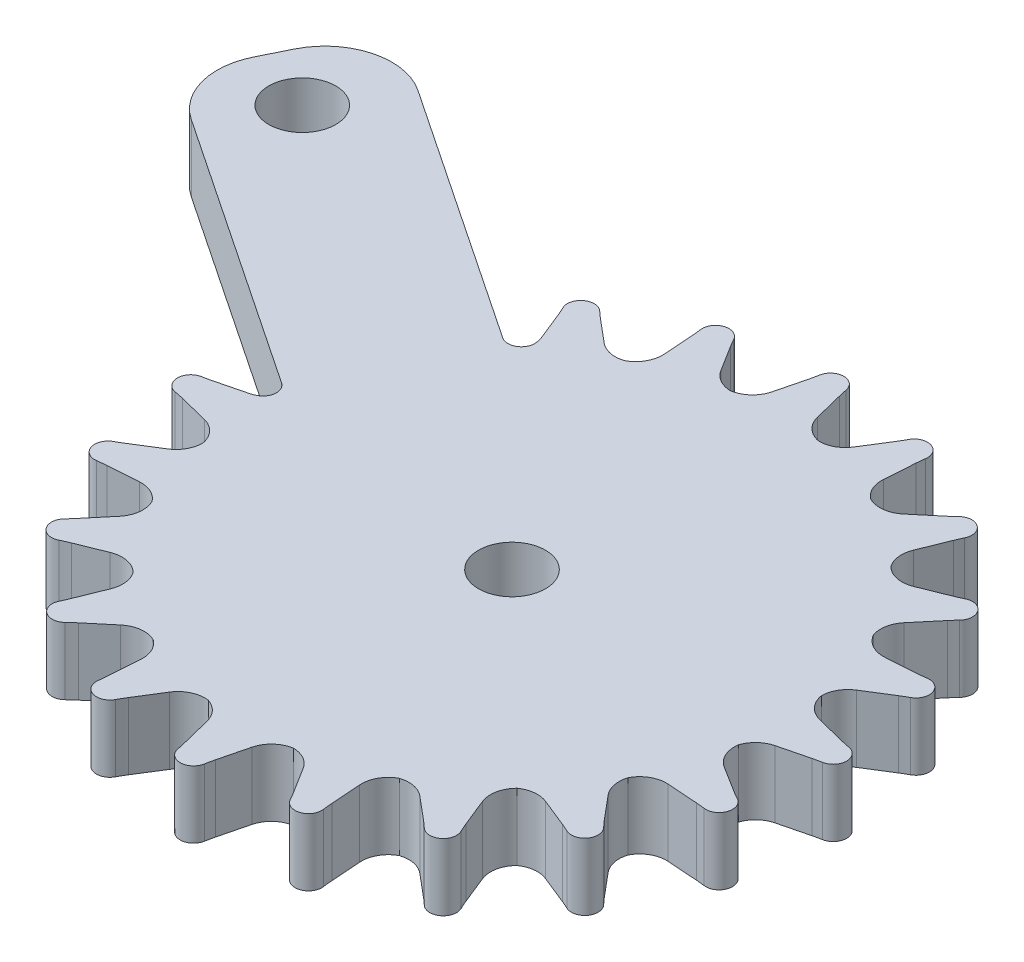
from build123d import *

# Parameters (mm, degrees)
SKETCH1_R           = 20
BOSS_EXTRUDE1_DEPTH = 5
BOSS_EXTRUDE2_START = -5
BOSS_EXTRUDE2_DEPTH = 5
FILLET1_R           = 2
CIRPATTERN1_DEPTH   = 5
SKETCH4_R           = 2.5
BOSS_EXTRUDE3_DEPTH = 5
FILLET2_R           = 5
SKETCH3_R           = 2.5
CUT_EXTRUDE1_DEPTH  = 10
FILLET3_R           = 1


# Read off the part's stored shape, not the designer's step: CirPattern1
with BuildPart() as part:
    # Sketch1 → Boss-Extrude1 (new body)
    with BuildSketch(Plane(origin=(0, 0, 0), x_dir=(1, 0, 0), z_dir=(0, 1, 0))):
        with Locations(Location((0, 0, 0), (0, 0, 270))):
            Circle(SKETCH1_R)
    extrude(amount=BOSS_EXTRUDE1_DEPTH)

    # Sketch2 → Boss-Extrude2 (add)
    with BuildSketch(Plane(origin=(0, 5, 0), x_dir=(1, 0, 0), z_dir=(0, 1, 0)).offset(BOSS_EXTRUDE2_START)):
        with BuildLine():
            Line((-2.105791814, 19.888832063), (-1.238592318, 23.357630049))
            ThreePointArc((-1.238592318, 23.357630049), (-1.158488111, 23.704119695), (-1.090754777, 24.053238521))
            ThreePointArc((-1.090754777, 24.053238521), (-0.109023339, 24.880258639), (0.877972386, 24.059528275))
            ThreePointArc((0.877972386, 24.059528275), (0.941143779, 23.742067411), (1.014556469, 23.426817347))
            Line((1.014556469, 23.426817347), (1.893724984, 19.910143286))
            ThreePointArc((1.893724984, 19.910143286), (-0.106567477, 19.999716082), (-2.105791814, 19.888832063))
        make_face()
    extrude(amount=BOSS_EXTRUDE2_DEPTH)

    # Fillet1
    fillet1_edges = [part.edges().sort_by_distance(p)[0] for p in [
        (1.893724984, 2.5, -19.910143286),
        (-2.105791814, 2.5, -19.888832063),
    ]]
    fillet(fillet1_edges, radius=FILLET1_R)

    # CirPattern1 outline → CirPattern1 (add)
    with BuildSketch(Plane(origin=(0, 0, 0), x_dir=(1, 0, 0), z_dir=(0, 1, 0))):
        with BuildLine():
            ThreePointArc((-18.818349161, -15.020578024), (-18.496093443, -14.870168545), (-18.16869336, -14.731312705))
            Line((-18.16869336, -14.731312705), (-16.10451314, -13.898848252))
            ThreePointArc((-16.10451314, -13.898848252), (-14.969635701, -13.791456908), (-13.960430105, -14.321535926))
            ThreePointArc((-13.960430105, -14.321535926), (-16.121714854, -11.835975249), (-17.845731798, -9.029388491))
            ThreePointArc((-17.845731798, -9.029388491), (-17.643410931, -10.160914391), (-18.097403186, -11.216933153))
            Line((-18.097403186, -11.216933153), (-19.549034688, -12.94914432))
            ThreePointArc((-19.549034688, -12.94914432), (-19.760926451, -13.193835771), (-19.980626471, -13.431541317))
            ThreePointArc((-19.980626471, -13.431541317), (-20.064469753, -14.712450836), (-18.818349161, -15.020578024))
        make_face()
        with BuildLine():
            ThreePointArc((-8.242021953, 19.611282475), (-8.490583131, 18.498764143), (-9.306579914, 17.702756009))
            ThreePointArc((-9.306579914, 17.702756009), (-6.422679306, 18.940675556), (-3.380631018, 19.712212811))
            ThreePointArc((-3.380631018, 19.712212811), (-4.340011374, 19.966775936), (-5.058856916, 20.651227642))
            Line((-5.058856916, 20.651227642), (-6.274384144, 22.593742485))
            ThreePointArc((-6.274384144, 22.593742485), (-6.441621387, 22.870877344), (-6.599801755, 23.153279533))
            ThreePointArc((-6.599801755, 23.153279533), (-7.792110102, 23.628842042), (-8.470228911, 22.53892747))
            ThreePointArc((-8.470228911, 22.53892747), (-8.42676349, 22.185964985), (-8.395875928, 21.831680188))
            Line((-8.395875928, 21.831680188), (-8.242021953, 19.611282475))
        make_face()
        with BuildLine():
            ThreePointArc((-13.898848252, 16.10451314), (-13.791456908, 14.969635701), (-14.321535926, 13.960430105))
            ThreePointArc((-14.321535926, 13.960430105), (-11.961321637, 16.028935855), (-9.306579913, 17.702756008))
            ThreePointArc((-9.306579913, 17.702756008), (-10.297669185, 17.648395093), (-11.192839131, 18.077211859))
            Line((-11.192839131, 18.077211859), (-12.94914432, 19.549034688))
            ThreePointArc((-12.94914432, 19.549034688), (-13.193835771, 19.760926451), (-13.431541317, 19.980626471))
            ThreePointArc((-13.431541317, 19.980626471), (-14.712450836, 20.064469753), (-15.020578024, 18.818349161))
            ThreePointArc((-15.020578024, 18.818349161), (-14.870168545, 18.496093443), (-14.731312705, 18.16869336))
            Line((-14.731312705, 18.16869336), (-13.898848252, 16.10451314))
        make_face()
        with BuildLine():
            ThreePointArc((-18.195158445, 11.021321851), (-17.742326793, 9.975175019), (-17.934600217, 8.851560036))
            ThreePointArc((-17.934600217, 8.851560036), (-16.329106467, 11.548172233), (-14.321535925, 13.960430104))
            ThreePointArc((-14.321535925, 13.960430104), (-15.247319388, 13.602466375), (-16.231188267, 13.733672628))
            Line((-16.231188267, 13.733672628), (-18.356352028, 14.59073117))
            ThreePointArc((-18.356352028, 14.59073117), (-18.654545583, 14.716638395), (-18.948508031, 14.852130478))
            ThreePointArc((-18.948508031, 14.852130478), (-20.192634375, 14.536047367), (-20.100608305, 13.255699721))
            ThreePointArc((-20.100608305, 13.255699721), (-19.857977897, 12.995695406), (-19.624745956, 12.727228237))
            Line((-19.624745956, 12.727228237), (-18.195158445, 11.021321851))
        make_face()
        with BuildLine():
            ThreePointArc((-20.710399757, 4.85928679), (-19.956454114, 4.004274704), (-19.792100881, 2.876237597))
            ThreePointArc((-19.792100881, 2.876237597), (-19.098484585, 5.936993052), (-17.934600215, 8.851560035))
            ThreePointArc((-17.934600215, 8.851560035), (-18.704455735, 8.225033474), (-19.680715605, 8.045785833))
            Line((-19.680715605, 8.045785833), (-21.966712103, 8.204185225))
            ThreePointArc((-21.966712103, 8.204185225), (-22.289218499, 8.231783236), (-22.610662757, 8.269804472))
            ThreePointArc((-22.610662757, 8.269804472), (-23.696222171, 7.584735387), (-23.213050996, 6.395490034))
            ThreePointArc((-23.213050996, 6.395490034), (-22.901950013, 6.223188155), (-22.597172338, 6.039933339))
            Line((-22.597172338, 6.039933339), (-20.710399757, 4.85928679))
        make_face()
        with BuildLine():
            ThreePointArc((-21.198362842, -1.778409119), (-20.217104661, -2.358591919), (-19.712212811, -3.380631018))
            ThreePointArc((-19.712212811, -3.380631018), (-19.998369964, -0.255340374), (-19.792100879, 2.876237597))
            ThreePointArc((-19.792100879, 2.876237597), (-20.330669633, 2.042476989), (-21.203757377, 1.570321461))
            Line((-21.203757377, 1.570321461), (-23.426817347, 1.014556469))
            ThreePointArc((-23.426817347, 1.014556469), (-23.74206741, 0.941143779), (-24.059528275, 0.877972386))
            ThreePointArc((-24.059528275, 0.877972386), (-24.880258639, -0.109023339), (-24.053238521, -1.090754777))
            ThreePointArc((-24.053238521, -1.090754777), (-23.704119695, -1.158488111), (-23.357630049, -1.238592318))
            Line((-23.357630049, -1.238592318), (-21.198362842, -1.778409119))
        make_face()
        with BuildLine():
            ThreePointArc((-19.579720151, -8.239834962), (-18.612665626, -8.414862877), (-17.845731799, -9.029388492))
            ThreePointArc((-17.845731799, -9.029388492), (-18.990179463, -6.274797518), (-19.71221281, -3.380631018))
            ThreePointArc((-19.71221281, -3.380631018), (-19.966775936, -4.340011374), (-20.651227642, -5.058856916))
            Line((-20.651227642, -5.058856916), (-22.593742485, -6.274384144))
            ThreePointArc((-22.593742485, -6.274384144), (-22.870877344, -6.441621387), (-23.153279533, -6.599801755))
            ThreePointArc((-23.153279533, -6.599801755), (-23.628842042, -7.792110102), (-22.53892747, -8.470228911))
            ThreePointArc((-22.53892747, -8.470228911), (-22.185964985, -8.42676349), (-21.831680188, -8.395875928))
            Line((-21.831680188, -8.395875928), (-19.579720151, -8.239834962))
        make_face()
        with BuildLine():
            ThreePointArc((3.184529229, 19.744841696), (6.085729599, 19.051611356), (8.851560036, 17.934600217))
            ThreePointArc((8.851560036, 17.934600217), (8.225033474, 18.704455735), (8.045785833, 19.680715605))
            Line((8.045785833, 19.680715605), (8.204185225, 21.966712103))
            ThreePointArc((8.204185225, 21.966712103), (8.231783236, 22.289218499), (8.269804472, 22.610662757))
            ThreePointArc((8.269804472, 22.610662757), (7.584735387, 23.696222171), (6.395490034, 23.213050996))
            ThreePointArc((6.395490034, 23.213050996), (6.223188155, 22.901950013), (6.039933339, 22.597172338))
            Line((6.039933339, 22.597172338), (4.842504233, 20.683579819))
            ThreePointArc((4.842504233, 20.683579819), (4.132483288, 20.004095101), (3.184529229, 19.744841696))
        make_face()
        with BuildLine():
            ThreePointArc((8.851560036, 17.934600217), (11.548172234, 16.329106469), (13.960430106, 14.321535927))
            ThreePointArc((13.960430106, 14.321535927), (13.602466375, 15.247319388), (13.733672628, 16.231188267))
            Line((13.733672628, 16.231188267), (14.59073117, 18.356352028))
            ThreePointArc((14.59073117, 18.356352028), (14.716638395, 18.654545583), (14.852130478, 18.948508031))
            ThreePointArc((14.852130478, 18.948508031), (14.536047367, 20.192634375), (13.255699721, 20.100608305))
            ThreePointArc((13.255699721, 20.100608305), (12.995695406, 19.857977897), (12.727228237, 19.624745956))
            Line((12.727228237, 19.624745956), (11.021321851, 18.195158445))
            ThreePointArc((11.021321851, 18.195158445), (9.975175019, 17.742326793), (8.851560036, 17.934600217))
        make_face()
        with BuildLine():
            ThreePointArc((13.960430106, 14.321535927), (16.028935857, 11.961321639), (17.70275601, 9.306579915))
            ThreePointArc((17.70275601, 9.306579915), (17.648395093, 10.297669185), (18.077211859, 11.192839131))
            Line((18.077211859, 11.192839131), (19.549034688, 12.94914432))
            ThreePointArc((19.549034688, 12.94914432), (19.760926451, 13.193835771), (19.980626471, 13.431541317))
            ThreePointArc((19.980626471, 13.431541317), (20.064469753, 14.712450836), (18.818349161, 15.020578024))
            ThreePointArc((18.818349161, 15.020578024), (18.496093443, 14.870168545), (18.16869336, 14.731312705))
            Line((18.16869336, 14.731312705), (16.10451314, 13.898848252))
            ThreePointArc((16.10451314, 13.898848252), (14.969635701, 13.791456908), (13.960430106, 14.321535927))
        make_face()
        with BuildLine():
            ThreePointArc((17.70275601, 9.306579915), (18.940675558, 6.422679307), (19.712212813, 3.380631018))
            ThreePointArc((19.712212813, 3.380631018), (19.966775936, 4.340011374), (20.651227642, 5.058856916))
            Line((20.651227642, 5.058856916), (22.593742485, 6.274384144))
            ThreePointArc((22.593742485, 6.274384144), (22.870877344, 6.441621387), (23.153279533, 6.599801755))
            ThreePointArc((23.153279533, 6.599801755), (23.628842042, 7.792110102), (22.53892747, 8.470228911))
            ThreePointArc((22.53892747, 8.470228911), (22.185964985, 8.42676349), (21.831680188, 8.395875928))
            Line((21.831680188, 8.395875928), (19.611282475, 8.242021953))
            ThreePointArc((19.611282475, 8.242021953), (18.498764143, 8.490583131), (17.70275601, 9.306579915))
        make_face()
        with BuildLine():
            ThreePointArc((19.712212813, 3.380631018), (19.998369968, 0.255340374), (19.792100883, -2.876237597))
            ThreePointArc((19.792100883, -2.876237597), (20.330669633, -2.042476989), (21.203757377, -1.570321461))
            Line((21.203757377, -1.570321461), (23.426817347, -1.014556469))
            ThreePointArc((23.426817347, -1.014556469), (23.74206741, -0.941143779), (24.059528275, -0.877972386))
            ThreePointArc((24.059528275, -0.877972386), (24.880258639, 0.109023339), (24.053238521, 1.090754777))
            ThreePointArc((24.053238521, 1.090754777), (23.704119695, 1.158488111), (23.357630049, 1.238592318))
            Line((23.357630049, 1.238592318), (21.198362842, 1.778409119))
            ThreePointArc((21.198362842, 1.778409119), (20.217104661, 2.358591919), (19.712212813, 3.380631018))
        make_face()
        with BuildLine():
            ThreePointArc((19.792100883, -2.876237597), (19.051611357, -6.085729599), (17.794386708, -9.130158911))
            ThreePointArc((17.794386708, -9.130158911), (18.590889166, -8.301383653), (19.712076244, -8.047958848))
            Line((19.712076244, -8.047958848), (21.966712103, -8.204185225))
            ThreePointArc((21.966712103, -8.204185225), (22.289218499, -8.231783236), (22.610662757, -8.269804472))
            ThreePointArc((22.610662757, -8.269804472), (23.696222171, -7.584735387), (23.213050996, -6.395490034))
            ThreePointArc((23.213050996, -6.395490034), (22.901950013, -6.223188155), (22.597172338, -6.039933339))
            Line((22.597172338, -6.039933339), (20.710399757, -4.85928679))
            ThreePointArc((20.710399757, -4.85928679), (19.956454114, -4.004274704), (19.792100883, -2.876237597))
        make_face()
        with BuildLine():
            ThreePointArc((17.794386708, -9.130158911), (16.238565258, -11.675144471), (14.321535927, -13.960430106))
            ThreePointArc((14.321535927, -13.960430106), (15.247319388, -13.602466375), (16.231188267, -13.733672628))
            Line((16.231188267, -13.733672628), (18.356352028, -14.59073117))
            ThreePointArc((18.356352028, -14.59073117), (18.654545583, -14.716638395), (18.948508031, -14.852130478))
            ThreePointArc((18.948508031, -14.852130478), (20.192634375, -14.536047367), (20.100608305, -13.255699721))
            ThreePointArc((20.100608305, -13.255699721), (19.857977897, -12.995695406), (19.624745956, -12.727228237))
            Line((19.624745956, -12.727228237), (18.174837264, -10.997072875))
            ThreePointArc((18.174837264, -10.997072875), (17.748017433, -10.111830503), (17.794386708, -9.130158911))
        make_face()
        with BuildLine():
            ThreePointArc((14.321535927, -13.960430106), (11.961321639, -16.028935857), (9.306579914, -17.70275601))
            ThreePointArc((9.306579914, -17.70275601), (10.297669185, -17.648395093), (11.192839131, -18.077211859))
            Line((11.192839131, -18.077211859), (12.94914432, -19.549034688))
            ThreePointArc((12.94914432, -19.549034688), (13.193835771, -19.760926451), (13.431541317, -19.980626471))
            ThreePointArc((13.431541317, -19.980626471), (14.712450836, -20.064469753), (15.020578024, -18.818349161))
            ThreePointArc((15.020578024, -18.818349161), (14.870168545, -18.496093443), (14.731312705, -18.16869336))
            Line((14.731312705, -18.16869336), (13.898848252, -16.10451314))
            ThreePointArc((13.898848252, -16.10451314), (13.791456908, -14.969635701), (14.321535927, -13.960430106))
        make_face()
        with BuildLine():
            ThreePointArc((9.306579914, -17.70275601), (6.422679306, -18.940675557), (3.380631018, -19.712212812))
            ThreePointArc((3.380631018, -19.712212812), (4.340011374, -19.966775936), (5.058856916, -20.651227642))
            Line((5.058856916, -20.651227642), (6.274384144, -22.593742485))
            ThreePointArc((6.274384144, -22.593742485), (6.441621387, -22.870877344), (6.599801755, -23.153279533))
            ThreePointArc((6.599801755, -23.153279533), (7.792110102, -23.628842042), (8.470228911, -22.53892747))
            ThreePointArc((8.470228911, -22.53892747), (8.42676349, -22.185964985), (8.395875928, -21.831680188))
            Line((8.395875928, -21.831680188), (8.242021953, -19.611282475))
            ThreePointArc((8.242021953, -19.611282475), (8.490583131, -18.498764143), (9.306579914, -17.70275601))
        make_face()
        with BuildLine():
            ThreePointArc((3.380631018, -19.712212812), (0.255340374, -19.998369966), (-2.876237597, -19.792100881))
            ThreePointArc((-2.876237597, -19.792100881), (-2.042476989, -20.330669633), (-1.570321461, -21.203757377))
            Line((-1.570321461, -21.203757377), (-1.014556469, -23.426817347))
            ThreePointArc((-1.014556469, -23.426817347), (-0.941143779, -23.74206741), (-0.877972386, -24.059528275))
            ThreePointArc((-0.877972386, -24.059528275), (0.109023339, -24.880258639), (1.090754777, -24.053238521))
            ThreePointArc((1.090754777, -24.053238521), (1.158488111, -23.704119695), (1.238592318, -23.357630049))
            Line((1.238592318, -23.357630049), (1.778409119, -21.198362842))
            ThreePointArc((1.778409119, -21.198362842), (2.358591919, -20.217104661), (3.380631018, -19.712212812))
        make_face()
        with BuildLine():
            ThreePointArc((-2.876237597, -19.792100881), (-5.936993053, -19.098484586), (-8.851560035, -17.934600216))
            ThreePointArc((-8.851560035, -17.934600216), (-8.225033474, -18.704455735), (-8.045785833, -19.680715605))
            Line((-8.045785833, -19.680715605), (-8.204185225, -21.966712103))
            ThreePointArc((-8.204185225, -21.966712103), (-8.231783236, -22.289218499), (-8.269804472, -22.610662757))
            ThreePointArc((-8.269804472, -22.610662757), (-7.584735387, -23.696222171), (-6.395490034, -23.213050996))
            ThreePointArc((-6.395490034, -23.213050996), (-6.223188155, -22.901950013), (-6.039933339, -22.597172338))
            Line((-6.039933339, -22.597172338), (-4.85928679, -20.710399757))
            ThreePointArc((-4.85928679, -20.710399757), (-4.004274704, -19.956454114), (-2.876237597, -19.792100881))
        make_face()
        with BuildLine():
            ThreePointArc((-8.851560035, -17.934600216), (-11.548172233, -16.329106468), (-13.960430104, -14.321535925))
            ThreePointArc((-13.960430104, -14.321535925), (-13.602466375, -15.247319388), (-13.733672628, -16.231188267))
            Line((-13.733672628, -16.231188267), (-14.59073117, -18.356352028))
            ThreePointArc((-14.59073117, -18.356352028), (-14.716638395, -18.654545583), (-14.852130478, -18.948508031))
            ThreePointArc((-14.852130478, -18.948508031), (-14.536047367, -20.192634375), (-13.255699721, -20.100608305))
            ThreePointArc((-13.255699721, -20.100608305), (-12.995695406, -19.857977897), (-12.727228237, -19.624745956))
            Line((-12.727228237, -19.624745956), (-11.021321851, -18.195158445))
            ThreePointArc((-11.021321851, -18.195158445), (-9.975175019, -17.742326793), (-8.851560035, -17.934600216))
        make_face()
    extrude(amount=CIRPATTERN1_DEPTH)

    # Sketch4 → Boss-Extrude3 (add)
    with BuildSketch(Plane.XZ):
        Polygon((-19.792100881, -2.876237597), (-44.719103129, -19.568887444), (-39.248538174, -30.653079953), (-14.321535926, -13.960430105), align=None)
        with Locations(Location((-37.849735461, -22.189822372, 0), (0, 0, 270))):
            Circle(SKETCH4_R, mode=Mode.SUBTRACT)
    extrude(amount=-BOSS_EXTRUDE3_DEPTH)

    # Fillet2
    fillet2_edges = [part.edges().sort_by_distance(p)[0] for p in [
        (-39.248538174, 2.5, -30.653079953),
        (-44.719103129, 2.5, -19.568887444),
    ]]
    fillet(fillet2_edges, radius=FILLET2_R)

    # Sketch3 → Cut-Extrude1 (cut)
    with BuildSketch(Plane(origin=(0, 5, 0), x_dir=(1, 0, 0), z_dir=(0, 1, 0))):
        with Locations(Location((0, 0, 0), (0, 0, 270))):
            Circle(SKETCH3_R)
    extrude(amount=-CUT_EXTRUDE1_DEPTH, mode=Mode.SUBTRACT)

    # Fillet3
    fillet3_edges = [part.edges().sort_by_distance(p)[0] for p in [
        (-14.321535926, 2.5, -13.960430105),
        (-19.792100881, 2.5, -2.876237597),
    ]]
    fillet(fillet3_edges, radius=FILLET3_R)


solid = part.part
